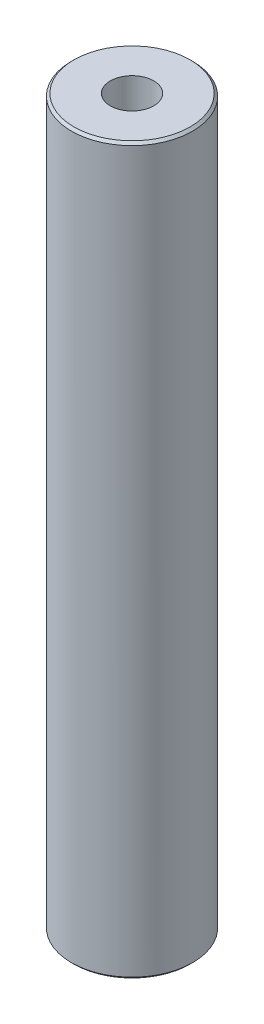
from build123d import *

# Parameters (mm, degrees)
SKETCH1_R           = 10
BOSS_EXTRUDE1_DEPTH = 119.697724196
SKETCH2_R           = 3.581555692
CUT_EXTRUDE1_DEPTH  = 121.530266645
CHAMFER1_SIZE       = 0.407471493


with BuildPart() as part:
    # Sketch1 → Boss-Extrude1 (new body)
    with BuildSketch(Plane(origin=(0, 0, 0), x_dir=(1, 0, 0), z_dir=(0, 1, 0))):
        Circle(SKETCH1_R)
    extrude(amount=BOSS_EXTRUDE1_DEPTH)

    # Sketch2 → Cut-Extrude1 (cut, through all)
    with BuildSketch(Plane(origin=(0, 0, 0), x_dir=(1, 0, 0), z_dir=(0, 1, 0))):
        Circle(SKETCH2_R)
    extrude(amount=CUT_EXTRUDE1_DEPTH, mode=Mode.SUBTRACT)

    # Chamfer1
    chamfer1_edges = [part.edges().sort_by_distance(p)[0] for p in [
        (-10, 119.697724196, 0),
        (-10, 0, 0),
    ]]
    chamfer(chamfer1_edges, length=CHAMFER1_SIZE)


solid = part.part
